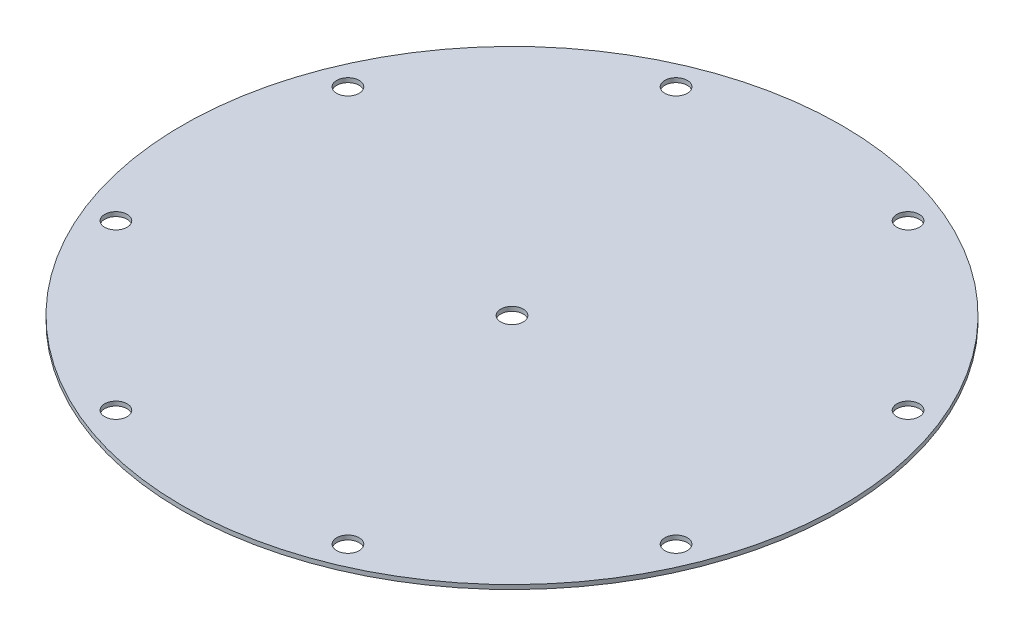
from build123d import *

# Parameters (mm, degrees)
SKETCH2_W                  = 76.09991
SKETCH2_H                  = 1
F_6_0_204_DIAMETER_HOLE1_D = 5.1816
CIRPATTERN3_COUNT          = 8
F_6_0_204_DIAMETER_HOLE2_D = 5.1816


with BuildPart() as part:
    # Sketch2 → Revolve1 (revolve)
    with BuildSketch(Plane(origin=(0, 0, 0), x_dir=(0, 0, -1), z_dir=(1, 0, 0))):
        with Locations((-38.049955, 0.5)):
            Rectangle(SKETCH2_W, SKETCH2_H)
    revolve(axis=Axis((0, -0.05, 0), (0, 1, 0)))

    # #6 (0.204) Diameter Hole1 (through all)
    with Locations(Plane(origin=(0, 1, 0), x_dir=(1, 0, 0), z_dir=(0, 1, 0))):
        with Locations((-26.787840266, 64.671567276)):
            f_6_0_204_diameter_hole1 = Hole(F_6_0_204_DIAMETER_HOLE1_D / 2)

    # CirPattern3: #6 (0.204) Diameter Hole1 ×8 about axis
    cirpattern3_axis = Axis((0, -0.05, 0), (0, 1, 0))
    for i in range(1, CIRPATTERN3_COUNT):
        add(f_6_0_204_diameter_hole1.rotate(cirpattern3_axis, i * 360 / CIRPATTERN3_COUNT), mode=Mode.SUBTRACT)

    # #6 (0.204) Diameter Hole2 (through all)
    with Locations(Plane(origin=(0, 1, 0), x_dir=(1, 0, 0), z_dir=(0, 1, 0))):
        with Locations((0, 0)):
            Hole(F_6_0_204_DIAMETER_HOLE2_D / 2)


solid = part.part
